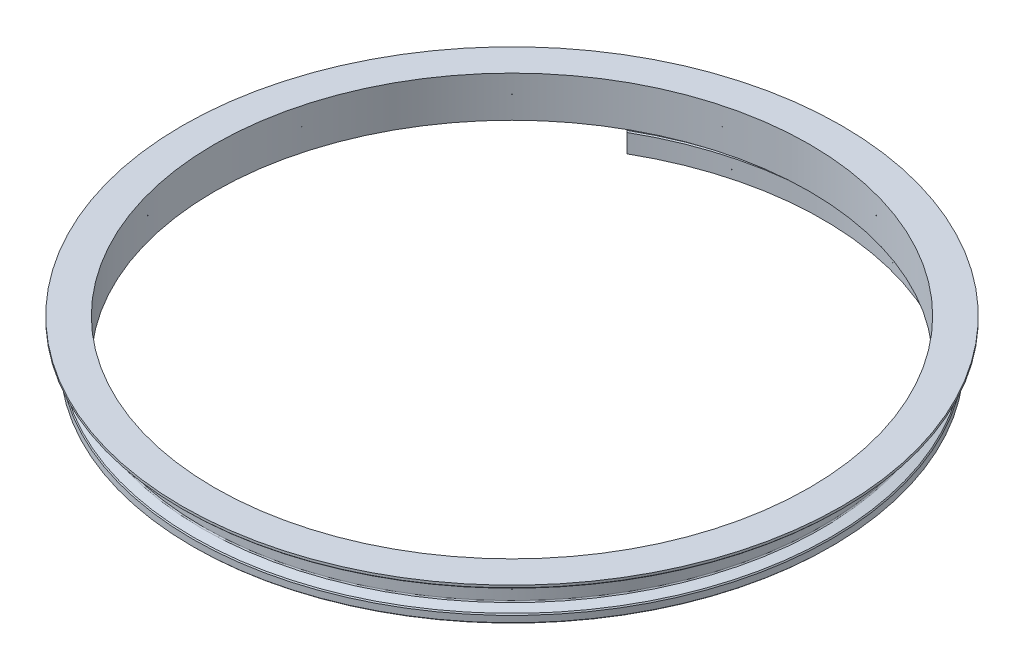
from build123d import *
from OCP.BRepFilletAPI import BRepFilletAPI_MakeChamfer

# Parameters (mm, degrees)
SKETCH3_W          = 84.455
SKETCH3_H          = 0.381
CUT_EXTRUDE1_DEPTH = 122.077195012
CIRPATTERN2_START  = -9.401919884
CIRPATTERN2_DEPTH  = 18.803839768
FILLET1_R          = 0.508
CHAMFER6_SIZE      = 0.254
CHAMFER6_SIZE2     = 0.197576926
CHAMFER5_SIZE      = 0.254
CHAMFER5_SIZE2     = 0.253429
CHAMFER2_SIZE      = 1.5
CHAMFER2_SIZE2     = 3.8
FILLET2_R          = 0.3175
CHAMFER4_SIZE      = 0.254
CHAMFER7_SIZE      = 0.254
CHAMFER7_SIZE2     = 0.197576926
CIRPATTERN5_COUNT  = 6


# Read off the part's stored shape, not the designer's step: moduleRing, CirPattern2, Mirror10
with BuildPart() as part:
    # moduleRing outline → moduleRing (revolve)
    with BuildSketch(Plane.XY):
        Polygon((76.2, 10.457412986), (76.2, 0), (81.8275, 0), (81.8275, 2.145588094), (79.2, 3.101919884), (79.2, 9.601919884), (84.455, 9.601919884), (84.455, 10.457412986), align=None)
    revolve(axis=Axis((0, 0, 0), (0, 1, 0)))

    # Fillet2
    fillet2_edges = [part.edges().sort_by_distance(p)[0] for p in [
        (-79.2, 9.601919884, 0),
        (-79.2, 3.101919884, 0),
    ]]
    fillet(fillet2_edges, radius=FILLET2_R)

    # Chamfer4
    chamfer4_edges = [part.edges().sort_by_distance(p)[0] for p in [
        (-84.455, 9.601919884, 0),
        (-81.8275, 0, 0),
    ]]
    chamfer(chamfer4_edges, length=CHAMFER4_SIZE)

    # Chamfer7
    chamfer7_edges = [part.edges().sort_by_distance(p)[0] for p in [
        (-81.8275, 2.145588094, 0),
    ]]
    chamfer7_side = [part.faces().sort_by_distance(p)[0] for p in [
        (-81.8275, 1.199794047, 0),
    ]]
    chamfer(chamfer7_edges, length=CHAMFER7_SIZE, length2=CHAMFER7_SIZE2, reference=chamfer7_side[0])

    # Sketch19 → Ø0.15 (0.15) Diameter Hole2 (revolve, cut)
    with BuildSketch(Plane(origin=(19.39331105, 5.801919884, -72.376822164), x_dir=(0.9659258262890699, 0, 0.25881904510251463), z_dir=(0, 1, 0))):
        Polygon((0, 0), (0, 5.245064546), (0.075, 5.2), (0.075, 0), align=None)
    f_0_15_0_15_diameter_hole2 = revolve(axis=Axis((17.749810113, 5.801919884, -66.243193167), (0.2588190451025147, 0, -0.9659258262890699)), mode=Mode.SUBTRACT)

    # Mirror8: Ø0.15 (0.15) Diameter Hole2 across plane
    add(f_0_15_0_15_diameter_hole2.mirror(Plane(origin=(0, 0, 0), x_dir=(0, 0, 1), z_dir=(1, 0, 0))), mode=Mode.SUBTRACT)

    # CirPattern5: Ø0.15 (0.15) Diameter Hole2 ×6 about axis
    cirpattern5_axis = Axis((0, 47.75171456, 0), (0, 1, 0))
    for i in range(1, CIRPATTERN5_COUNT):
        add(f_0_15_0_15_diameter_hole2.rotate(cirpattern5_axis, i * 360 / CIRPATTERN5_COUNT), mode=Mode.SUBTRACT)

    # CirPattern5 copy 1 sketch → CirPattern5 copy 1 (revolve, cut)
    with BuildSketch(Plane(origin=(-72.376822164, 5.801919884, -19.39331105), x_dir=(-0.25881904510252696, 0, 0.9659258262890666), z_dir=(0, 1, 0))):
        Polygon((0, 0), (0, -5.245064546), (0.075, -5.2), (0.075, 0), align=None)
    revolve(axis=Axis((-66.243193167, 5.801919884, -17.749810113), (0.9659258262890666, 0, 0.25881904510252696)), mode=Mode.SUBTRACT)

    # CirPattern5 copy 2 sketch → CirPattern5 copy 2 (revolve, cut)
    with BuildSketch(Plane(origin=(-52.983511114, 5.801919884, 52.983511114), x_dir=(0.7071067811865428, 0, 0.7071067811865521), z_dir=(0, 1, 0))):
        Polygon((0, 0), (0, -5.245064546), (0.075, -5.2), (0.075, 0), align=None)
    revolve(axis=Axis((-48.493383054, 5.801919884, 48.493383054), (0.7071067811865521, 0, -0.7071067811865428)), mode=Mode.SUBTRACT)

    # CirPattern5 copy 3 sketch → CirPattern5 copy 3 (revolve, cut)
    with BuildSketch(Plane(origin=(19.39331105, 5.801919884, 72.376822164), x_dir=(0.9659258262890699, 0, -0.2588190451025145), z_dir=(0, 1, 0))):
        Polygon((0, 0), (0, -5.245064546), (0.075, -5.2), (0.075, 0), align=None)
    revolve(axis=Axis((17.749810113, 5.801919884, 66.243193167), (-0.2588190451025146, 0, -0.9659258262890699)), mode=Mode.SUBTRACT)

    # CirPattern5 copy 4 sketch → CirPattern5 copy 4 (revolve, cut)
    with BuildSketch(Plane(origin=(72.376822164, 5.801919884, 19.39331105), x_dir=(0.2588190451025274, 0, -0.9659258262890664), z_dir=(0, 1, 0))):
        Polygon((0, 0), (0, -5.245064546), (0.075, -5.2), (0.075, 0), align=None)
    revolve(axis=Axis((66.243193167, 5.801919884, 17.749810113), (-0.9659258262890665, 0, -0.2588190451025273)), mode=Mode.SUBTRACT)

    # CirPattern5 copy 5 sketch → CirPattern5 copy 5 (revolve, cut)
    with BuildSketch(Plane(origin=(52.983511114, 5.801919884, -52.983511114), x_dir=(-0.7071067811865431, 0, -0.7071067811865519), z_dir=(0, 1, 0))):
        Polygon((0, 0), (0, -5.245064546), (0.075, -5.2), (0.075, 0), align=None)
    revolve(axis=Axis((48.493383054, 5.801919884, -48.493383054), (-0.7071067811865519, 0, 0.7071067811865431)), mode=Mode.SUBTRACT)


with BuildPart() as body_2:
    # Sketch1<5> → clampArc (revolve)
    with BuildSketch(Plane.XY, mode=Mode.PRIVATE) as clamparc_sk:
        Polygon((79.6, 9.401919884), (79.6, 2.956331791), (82.2275, 2), (82.2275, -2), (79.6, -2.956331791), (79.6, -9.401919884), (84.455, -9.401919884), (84.455, 9.401919884), align=None)
    revolve(clamparc_sk.sketch.rotate(Axis((0, 47.75171456, 0), (0, -1, 0)), 90), axis=Axis((0, 47.75171456, 0), (0, -1, 0)))

    # Sketch3 → Cut-Extrude1 (cut, symmetric)
    with BuildSketch(Plane.XZ.offset(9.401919884)):
        with Locations((42.2275, 0)):
            Rectangle(SKETCH3_W, SKETCH3_H)
    extrude(amount=CUT_EXTRUDE1_DEPTH, both=True, mode=Mode.SUBTRACT)

    # CirPattern2 outline → CirPattern2 (cut)
    with BuildSketch(Plane(origin=(0, 0, 0), x_dir=(1, 0, 0), z_dir=(0, 1, 0)).offset(CIRPATTERN2_START)):
        with BuildLine():
            ThreePointArc((84.45478515, 0.1905), (73.044739411, 42.392370414), (42.062414736, 73.235239411))
            Line((42.062414736, 73.235239411), (39.634908184, 69.030674727))
            ThreePointArc((39.634908184, 69.030674727), (68.840174727, 39.964863862), (79.599772046, 0.1905))
            Line((79.599772046, 0.1905), (84.45478515, 0.1905))
        make_face()
        with BuildLine():
            ThreePointArc((-42.062414736, 73.235239411), (-42.392370414, -73.044739411), (84.45478515, -0.1905))
            Line((84.45478515, -0.1905), (79.599772046, -0.1905))
            ThreePointArc((79.599772046, -0.1905), (-39.964863862, -68.840174727), (-39.634908183, 69.030674727))
            Line((-39.634908183, 69.030674727), (-42.062414736, 73.235239411))
        make_face()
    extrude(amount=CIRPATTERN2_DEPTH, mode=Mode.SUBTRACT)

    # Fillet1
    fillet1_edges = [body_2.edges().sort_by_distance(p)[0] for p in [
        (0, 2, -82.2275),
        (0, -2, -82.2275),
    ]]
    fillet(fillet1_edges, radius=FILLET1_R)

    # Chamfer6: one chamfer whose edges measure the first distance from different faces: ONE call of the kernel's chamfer builder (chamfer() names one face for all edges)
    chamfer6_edges_1 = [body_2.edges().sort_by_distance(p)[0] for p in [
        (0, -2.956331791, -79.6),
    ]]
    chamfer6_side_1 = [body_2.faces().sort_by_distance(p)[0] for p in [
        (0, -2.538995106, -80.746623116),
    ]]
    chamfer6_edges_2 = [body_2.edges().sort_by_distance(p)[0] for p in [
        (0, 2.956331791, -79.6),
    ]]
    chamfer6_side_2 = [body_2.faces().sort_by_distance(p)[0] for p in [
        (0, 6.179125837, -79.6),
    ]]
    chamfer6 = BRepFilletAPI_MakeChamfer(body_2.part.solid().wrapped)
    for e in chamfer6_edges_1:
        chamfer6.Add(CHAMFER6_SIZE, CHAMFER6_SIZE2, e.wrapped, chamfer6_side_1[0].wrapped)  # the first distance lies on this face
    for e in chamfer6_edges_2:
        chamfer6.Add(CHAMFER6_SIZE, CHAMFER6_SIZE2, e.wrapped, chamfer6_side_2[0].wrapped)  # the first distance lies on this face
    add(Compound.cast(chamfer6.Shape()), mode=Mode.REPLACE)

    # Sketch17 → Ø0.15 (0.15) Diameter Hole1 (revolve, cut)
    with BuildSketch(Plane(origin=(21.858562454, -5.801919884, -81.577265659), x_dir=(-0.9659258262890681, 0, -0.2588190451025214), z_dir=(0, 1, 0))):
        Polygon((0, 0), (0, 5.245064546), (0.075, 5.2), (0.075, 0), align=None)
    f_0_15_0_15_diameter_hole1 = revolve(axis=Axis((23.502063391, -5.801919884, -87.710894656), (-0.2588190451025214, 0, 0.9659258262890682)), mode=Mode.SUBTRACT)

    # Mirror5: Ø0.15 (0.15) Diameter Hole1 across plane
    add(f_0_15_0_15_diameter_hole1.mirror(Plane.ZX), mode=Mode.SUBTRACT)

    # Mirror6: Ø0.15 (0.15) Diameter Hole1 across plane
    add(f_0_15_0_15_diameter_hole1.mirror(Plane(origin=(0, 0, 0), x_dir=(0, 0, 1), z_dir=(1, 0, 0))), mode=Mode.SUBTRACT)

    # Mirror6 copy 1 sketch → Mirror6 copy 1 (revolve, cut)
    with BuildSketch(Plane(origin=(-21.858562454, 5.801919884, -81.577265659), x_dir=(0.9659258262890681, 0, -0.2588190451025214), z_dir=(0, -1, 0))):
        Polygon((0, 0), (0, 5.245064546), (0.075, 5.2), (0.075, 0), align=None)
    revolve(axis=Axis((-23.502063391, 5.801919884, -87.710894656), (0.2588190451025214, 0, 0.9659258262890682)), mode=Mode.SUBTRACT)

    # Chamfer5: one chamfer whose edges measure the first distance from different faces: ONE call of the kernel's chamfer builder (chamfer() names one face for all edges)
    chamfer5_edges_1 = [body_2.edges().sort_by_distance(p)[0] for p in [
        (0, 9.401919884, -84.455),
        (0, -9.401919884, -84.455),
    ]]
    chamfer5_edges_2 = [body_2.edges().sort_by_distance(p)[0] for p in [
        (-42.062414736, 0, -73.235239411),
    ]]
    chamfer5_side_2 = [body_2.faces().sort_by_distance(p)[0] for p in [
        (-40.949094764, -7.604e-06, -71.306912655),
    ]]
    chamfer5_edges_3 = [body_2.edges().sort_by_distance(p)[0] for p in [
        (42.062414736, 0, -73.235239411),
    ]]
    chamfer5_side_3 = [body_2.faces().sort_by_distance(p)[0] for p in [
        (40.949094765, -7.604e-06, -71.306912655),
    ]]
    chamfer5 = BRepFilletAPI_MakeChamfer(body_2.part.solid().wrapped)
    for e in chamfer5_edges_1:
        chamfer5.Add(CHAMFER5_SIZE, e.wrapped)
    for e in chamfer5_edges_2:
        chamfer5.Add(CHAMFER5_SIZE, CHAMFER5_SIZE2, e.wrapped, chamfer5_side_2[0].wrapped)  # the first distance lies on this face
    for e in chamfer5_edges_3:
        chamfer5.Add(CHAMFER5_SIZE, CHAMFER5_SIZE2, e.wrapped, chamfer5_side_3[0].wrapped)  # the first distance lies on this face
    add(Compound.cast(chamfer5.Shape()), mode=Mode.REPLACE)

    # Chamfer2
    chamfer2_edges = [body_2.edges().sort_by_distance(p)[0] for p in [
        (0, -9.401919884, -79.6),
    ]]
    chamfer2_side = [body_2.faces().sort_by_distance(p)[0] for p in [
        (0, -6.277914299, -79.6),
    ]]
    chamfer(chamfer2_edges, length=CHAMFER2_SIZE, length2=CHAMFER2_SIZE2, reference=chamfer2_side[0])

    # Mirror10 outline → Mirror10 (revolve, cut)
    with BuildSketch(Plane.XY):
        Polygon((79.6, 9.401919884), (79.6, 7.901919884), (83.4, 9.401919884), align=None)
    revolve(axis=Axis((0, 0, 0), (0, 1, 0)), mode=Mode.SUBTRACT)


solid = Compound([part.part, body_2.part])
